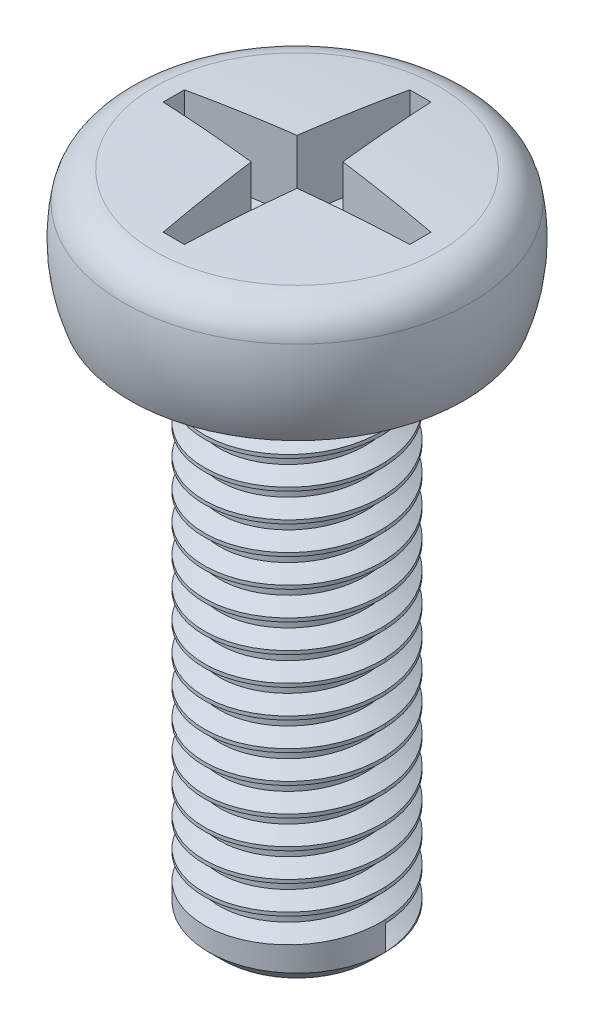
from build123d import *

# Parameters (mm, degrees)
FILLET1_R                 = 1
CUT_EXTRUDE1_REACH        = 11.89
CUT_EXTRUDE1_START_RADIUS = 44.099225113
CUT_EXTRUDE1_END_RADIUS   = 44.099225113
SKETCH3_R                 = 2.5
BOSS_EXTRUDE1_DEPTH       = 15
CHAMFER1_SIZE             = 0.4
THREAD1_PITCH             = 0.8


with BuildPart() as part:
    # Sketch1 → Revolve1 (revolve)
    with BuildSketch(Plane.XY):
        with BuildLine():
            Line((4.713877262, -0.272833551), (0, -0.272833551))
            Line((0, -0.272833551), (0, 3.227166449))
            ThreePointArc((0, 3.227166449), (2.360325965, 3.163955199), (4.713885409, 2.97450266))
            ThreePointArc((4.713885409, 2.97450266), (5, 1.350833837), (4.713877262, -0.272833551))
        make_face()
    revolve(axis=Axis((0, 3.227166449, 0), (0, -1, 0)))

    # Fillet1
    fillet1_edges = [part.edges().sort_by_distance(p)[0] for p in [
        (-4.713885409, 2.97450266, 0),
    ]]
    fillet(fillet1_edges, radius=FILLET1_R)

    # Cut-Extrude1: from a sphere face, 11.89 long prism both ways, kept between that surface and its translate by the depth
    cut_extrude1_start = Location((0, -40.872058664, 0)) * Sphere(CUT_EXTRUDE1_START_RADIUS, mode=Mode.PRIVATE)
    cut_extrude1_end = Location((0, -42.872058664, 0)) * Sphere(CUT_EXTRUDE1_END_RADIUS, mode=Mode.PRIVATE)
    # Sketch2 → Cut-Extrude1 (cut, from a surface)
    with BuildSketch(Plane.XZ.offset(0.272833551), mode=Mode.PRIVATE) as cut_extrude1_sk1:
        Polygon((-0.3, -3.485046478), (0.3, -3.485046478), (0.64729074, -0.64729074), (3.485046478, -0.3), (3.485046478, 0.3), (0.64729074, 0.64729074), (0.3, 3.485046478), (-0.3, 3.485046478), (-0.64729074, 0.64729074), (-3.485046478, 0.3), (-3.485046478, -0.3), (-0.64729074, -0.64729074), align=None)
    cut_extrude1_tool1 = extrude(cut_extrude1_sk1.sketch, amount=CUT_EXTRUDE1_REACH, both=True, mode=Mode.PRIVATE)
    add(((cut_extrude1_tool1 & cut_extrude1_start) - cut_extrude1_end).solids().sort_by_distance((0, 2.152942, 0))[0], mode=Mode.SUBTRACT)

    # Sketch3 → Boss-Extrude1 (add)
    with BuildSketch(Plane.XZ.offset(0.272833551)):
        Circle(SKETCH3_R)
    extrude(amount=BOSS_EXTRUDE1_DEPTH)

    # Chamfer1
    chamfer1_edges = [part.edges().sort_by_distance(p)[0] for p in [
        (-2.5, -15.272833551, 0),
    ]]
    chamfer(chamfer1_edges, length=CHAMFER1_SIZE)

    # Thread1: the profile of Thread Profile1 profile screwed along a right-hand helix of 17 turns, 8 arcs to a turn; built about Z, then put on its axis
    thread1_z = Axis((0, 0, 0), (0, 0, 1))
    thread1_corners = [(2.5003, 0, -0.000173205), (2.5003, 0, 0.700173203), (2.0669873, 0, 0.449999999), (2.0669873, 0, 0.249999999)]
    with BuildLine(mode=Mode.PRIVATE) as thread1_profile:
        Line(thread1_corners[0], thread1_corners[1])
        Line(thread1_corners[1], thread1_corners[2])
        Line(thread1_corners[2], thread1_corners[3])
        Line(thread1_corners[3], thread1_corners[0])
    thread1_cap = Face(thread1_profile.wire())
    thread1_turn_angles = [0, 22.5, 45, 67.5, 90, 112.5, 135, 157.5, 180, 202.5, 225, 247.5, 270, 292.5, 315, 337.5, 360]
    thread1_turn_weights = [1, 0.9238795325112867, 1, 0.9238795325112867, 1, 0.9238795325112867, 1, 0.9238795325112867, 1, 0.9238795325112867, 1, 0.9238795325112867, 1, 0.9238795325112867, 1, 0.9238795325112867, 1]
    thread1_turn_rails = [Edge.make_bspline([Vector(p[0], p[1], 0).rotate(thread1_z, thread1_turn_angles[k]) / thread1_turn_weights[k] + Vector(0, 0, p[2] + THREAD1_PITCH * thread1_turn_angles[k] / 360) for k in range(17)], [0, 0, 0, 1, 1, 2, 2, 3, 3, 4, 4, 5, 5, 6, 6, 7, 7, 8, 8, 8], 2, thread1_turn_weights) for p in thread1_corners]
    thread1_turn_sides = [Face.make_surface_from_curves(thread1_turn_rails[p[0]], thread1_turn_rails[p[1]]) for p in [(0, 1), (1, 2), (2, 3), (3, 0)]]
    thread1 = Plane(origin=(0, -14.872833551, 0), x_dir=(1, 0, 0), z_dir=(0, 1, 0)) * Solid(Shell([*[p.moved(Location((0, 0, THREAD1_PITCH * i))) for i in range(17) for p in thread1_turn_sides], thread1_cap, thread1_cap.rotate(thread1_z, 6120).moved(Location((0, 0, THREAD1_PITCH * 6120 / 360)))]))
    add(thread1, mode=Mode.SUBTRACT)


solid = part.part
